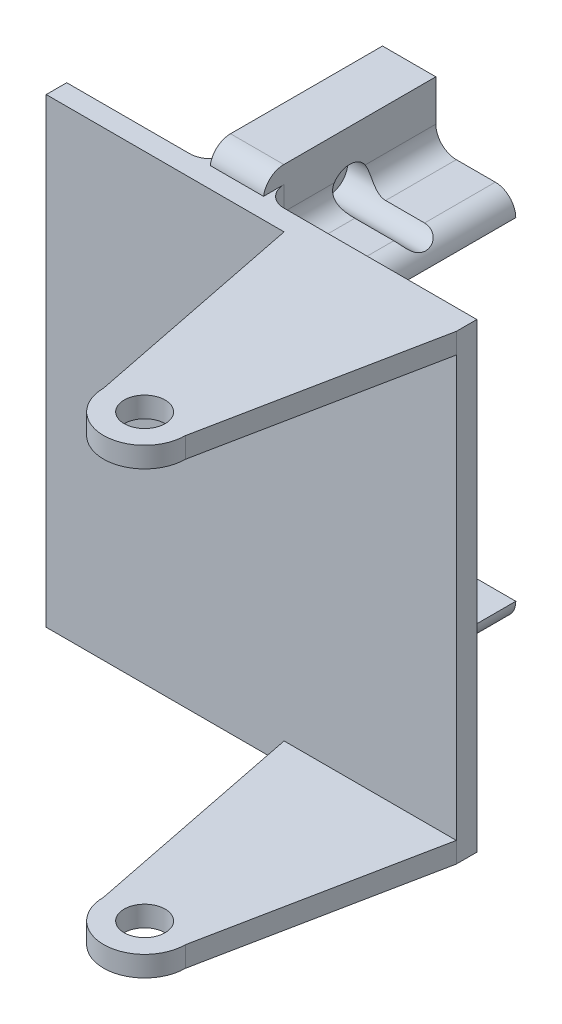
from build123d import *

# Parameters (mm, degrees)
SKETCH1_W           = 8.4
SKETCH1_H           = 22.5
BOSS_EXTRUDE1_DEPTH = 1
SKETCH2_R           = 1
BOSS_EXTRUDE2_DEPTH = 1
BOSS_EXTRUDE3_START = -21.5
SKETCH2_2_R         = 1
BOSS_EXTRUDE3_DEPTH = 1
SKETCH1_3_W         = 11.6
SKETCH1_3_H         = 22.5
BOSS_EXTRUDE4_DEPTH = 1
BOSS_EXTRUDE5_DEPTH = 8.4
FILLET2_R           = 1
SKETCH4_R           = 0.902238409
CUT_EXTRUDE1_DEPTH  = 23.614375959


with BuildPart() as part:
    # Sketch1 → Boss-Extrude1 (new body)
    with BuildSketch(Plane.XY):
        Rectangle(SKETCH1_W, SKETCH1_H)
    extrude(amount=BOSS_EXTRUDE1_DEPTH)

    # Sketch2 → Boss-Extrude2 (add)
    with BuildSketch(Plane(origin=(0, 11.25, 0), x_dir=(1, 0, 0), z_dir=(0, 1, 0))):
        with BuildLine():
            Line((-2, -12), (-4.2, -1))
            Line((-4.2, -1), (4.2, -1))
            Line((4.2, -1), (2, -12))
            ThreePointArc((2, -12), (0, -14), (-2, -12))
        make_face()
        with Locations(Location((0, -12, 0), (0, 0, 270))):
            Circle(SKETCH2_R, mode=Mode.SUBTRACT)
    extrude(amount=-BOSS_EXTRUDE2_DEPTH)

    # Sketch2<2> → Boss-Extrude3 (add)
    with BuildSketch(Plane(origin=(0, 11.25, 0), x_dir=(1, 0, 0), z_dir=(0, 1, 0)).offset(BOSS_EXTRUDE3_START)):
        with BuildLine():
            Line((-2, -12), (-4.2, -1))
            Line((-4.2, -1), (4.2, -1))
            Line((4.2, -1), (2, -12))
            ThreePointArc((2, -12), (0, -14), (-2, -12))
        make_face()
        with Locations(Location((0, -12, 0), (0, 0, 270))):
            Circle(SKETCH2_2_R, mode=Mode.SUBTRACT)
    extrude(amount=-BOSS_EXTRUDE3_DEPTH)

    # Sketch1<3> → Boss-Extrude4 (add)
    with BuildSketch(Plane.XY):
        with Locations((-10, 0)):
            Rectangle(SKETCH1_3_W, SKETCH1_3_H)
    extrude(amount=BOSS_EXTRUDE4_DEPTH)

    # Sketch3 → Boss-Extrude5 (add)
    with BuildSketch(Plane(origin=(0, 0, 0), x_dir=(-1, 0, 0), z_dir=(0, 0, -1))):
        Polygon((2.3, 8.1), (7.2, 8.1), (7.2, 11.1), (7.8, 11.1), (7.8, 8.1), (11.8, 8.1), (11.8, 9.1), (8.8, 9.1), (8.8, 12.1), (6.2, 12.1), (6.2, 9.1), (2.3, 9.1), align=None)
    extrude(amount=BOSS_EXTRUDE5_DEPTH)

    # Fillet2
    # the kernel refuses this fillet: 1 mm, written as the material it adds along each edge
    with BuildSketch(Plane(origin=(-6.2, 11.25, 0), x_dir=(1, 0, 0), z_dir=(0, -1, 0))) as fillet2_piece_1_section:
        with BuildLine():
            CenterArc((FILLET2_R, -FILLET2_R), FILLET2_R, 90, 90)
            Line((0, -FILLET2_R), (0, 0))
            Line((0, 0), (FILLET2_R, 0))
        make_face()
    fillet2_piece_1 = extrude(amount=4.65, mode=Mode.PRIVATE)
    fillet2_piece_1 = split(fillet2_piece_1, bisect_by=Plane(origin=(-6.2, 8.1, 0), z_dir=(0, 1, 0)), keep=Keep.TOP, mode=Mode.PRIVATE)
    add(fillet2_piece_1)
    with BuildSketch(Plane(origin=(-8.8, 9.1, 0), x_dir=(-1, 0, 0), z_dir=(0, 1, 0))) as fillet2_piece_2:
        with BuildLine():
            CenterArc((FILLET2_R, -FILLET2_R), FILLET2_R, 90, 90)
            Line((0, -FILLET2_R), (0, 0))
            Line((0, 0), (FILLET2_R, 0))
        make_face()
    extrude(amount=2.15)
    with BuildSketch(Plane(origin=(-8.8, 9.1, 2.5), x_dir=(-1, 0, 0), z_dir=(0, 0, -1))) as fillet2_piece_3_section:
        with BuildLine():
            CenterArc((FILLET2_R, FILLET2_R), FILLET2_R, 180, 90)
            Line((0, FILLET2_R), (0, 0))
            Line((0, 0), (FILLET2_R, 0))
        make_face()
    fillet2_piece_3 = extrude(amount=10.9, mode=Mode.PRIVATE)
    fillet2_piece_3 = split(fillet2_piece_3, bisect_by=Plane(origin=(-8.8, 9.1, 1), z_dir=(0, 0, -1)), keep=Keep.TOP, mode=Mode.PRIVATE)
    add(fillet2_piece_3)
    with BuildSketch(Plane(origin=(-6.2, 9.1, 2.5), x_dir=(0, 1, 0), z_dir=(0, 0, -1))) as fillet2_piece_4_section:
        with BuildLine():
            CenterArc((FILLET2_R, FILLET2_R), FILLET2_R, 180, 90)
            Line((0, FILLET2_R), (0, 0))
            Line((0, 0), (FILLET2_R, 0))
        make_face()
    fillet2_piece_4 = extrude(amount=10.9, mode=Mode.PRIVATE)
    fillet2_piece_4 = split(fillet2_piece_4, bisect_by=Plane(origin=(-6.2, 9.1, 1), z_dir=(0, 0, -1)), keep=Keep.TOP, mode=Mode.PRIVATE)
    add(fillet2_piece_4)
    # the kernel refuses this fillet: 1 mm, written as the material it takes off along each edge
    with BuildSketch(Plane(origin=(-2.3, 9.1, 0), x_dir=(-1, 0, 0), z_dir=(0, 0, -1)), Plane(origin=(-11.8, 9.1, 0), x_dir=(0, -1, 0), z_dir=(0, 0, -1))) as fillet2_2_piece_1:
        with BuildLine():
            CenterArc((FILLET2_R, -FILLET2_R), FILLET2_R, 90, 90)
            Line((0, -FILLET2_R), (0, 0))
            Line((0, 0), (FILLET2_R, 0))
        make_face()
    extrude(amount=10.9, mode=Mode.SUBTRACT)
    with BuildSketch(Plane(origin=(-11.271714992, 12.1, 0), x_dir=(0, 0, -1), z_dir=(1, 0, 0))) as fillet2_2_piece_2:
        with BuildLine():
            CenterArc((0.988685997, -1), FILLET2_R, 90, 81.373073441)
            Line((0, -0.85), (0, 0))
            Line((0, 0), (0.988685997, 0))
        make_face()
    extrude(amount=7.543429983, mode=Mode.SUBTRACT)
    # the kernel refuses this fillet: 1 mm, written as the material it adds along each edge
    with BuildSketch(Plane(origin=(-5.2, 10.1, -1), x_dir=(0, -1, 0), z_dir=(0, 0, 1))) as fillet2_3_piece_1_section:
        Polygon((0, 0), (FILLET2_R * 1.02, 0), (FILLET2_R * 1.02, -FILLET2_R * 1.02), (0, -FILLET2_R * 1.02), align=None)
    fillet2_3_piece_1 = extrude(amount=FILLET2_R * 1.02, mode=Mode.PRIVATE)
    fillet2_3_piece_1 = fillet2_3_piece_1 - Plane(origin=(-5.2, 10.1, -1), x_dir=(0.7071067811865475, 0.7071067811865475, 0), z_dir=(0, 0, 1)) * Sphere(FILLET2_R, mode=Mode.PRIVATE)
    add(fillet2_3_piece_1)
    with BuildSketch(Plane(origin=(-9.8, 10.1, -1), x_dir=(0, -1, 0), z_dir=(0, 0, 1))) as fillet2_3_piece_2_section:
        Polygon((0, 0), (FILLET2_R * 1.02, 0), (FILLET2_R * 1.02, FILLET2_R * 1.02), (0, FILLET2_R * 1.02), align=None)
    fillet2_3_piece_2 = extrude(amount=FILLET2_R * 1.02, mode=Mode.PRIVATE)
    fillet2_3_piece_2 = fillet2_3_piece_2 - Plane(origin=(-9.8, 10.1, -1), x_dir=(-0.7071067811865475, 0.7071067811865475, 0), z_dir=(0, 0, 1)) * Sphere(FILLET2_R, mode=Mode.PRIVATE)
    add(fillet2_3_piece_2)
    with BuildSketch(Plane(origin=(-10.8, 9.1, 0), x_dir=(0, 1, 0), z_dir=(1, 0, 0))) as fillet2_3_piece_3:
        with BuildLine():
            CenterArc((FILLET2_R, -FILLET2_R), FILLET2_R, 90, 90)
            Line((0, -FILLET2_R), (0, 0))
            Line((0, 0), (FILLET2_R, 0))
        make_face()
    extrude(amount=1)
    with BuildSketch(Plane(origin=(-5.2, 9.1, 0), x_dir=(0, 1, 0), z_dir=(1, 0, 0))) as fillet2_3_piece_4:
        with BuildLine():
            CenterArc((FILLET2_R, -FILLET2_R), FILLET2_R, 90, 90)
            Line((0, -FILLET2_R), (0, 0))
            Line((0, 0), (FILLET2_R, 0))
        make_face()
    extrude(amount=1.9)
    with BuildSketch(Plane(origin=(-3.3, 8.1, 0), x_dir=(0, 1, 0), z_dir=(-1, 0, 0))) as fillet2_3_piece_5:
        with BuildLine():
            CenterArc((1 + FILLET2_R, FILLET2_R), FILLET2_R, 180, 90)
            Line((1, FILLET2_R), (1, 0))
            Line((1, 0), (1 + FILLET2_R, 0))
        make_face()
    revolve(axis=Axis((-3.3, 8.1, 0), (0, 0, -1)), revolution_arc=90)
    with BuildSketch(Plane(origin=(-10.8, 8.1, 0), x_dir=(-1, 0, 0), z_dir=(0, -1, 0))) as fillet2_3_piece_6:
        with BuildLine():
            CenterArc((1 + FILLET2_R, FILLET2_R), FILLET2_R, 180, 90)
            Line((1, FILLET2_R), (1, 0))
            Line((1, 0), (1 + FILLET2_R, 0))
        make_face()
    revolve(axis=Axis((-10.8, 8.1, 0), (0, 0, -1)), revolution_arc=90)

    # Sketch4 → Cut-Extrude1 (cut, symmetric)
    with BuildSketch(Plane.ZY.offset(8.8)):
        with Locations(Location((-4.2, 9.6, 0), (0, 0, 33.654064464))):
            Circle(SKETCH4_R)
    extrude(amount=CUT_EXTRUDE1_DEPTH, both=True, mode=Mode.SUBTRACT)

    # Mirror1: read off the stored shape, not the designer's step
    # Mirror1: part across plane


with BuildPart() as part_1:
    add(part.part)
    add(part.part.mirror(Plane.ZX))


solid = part_1.part
